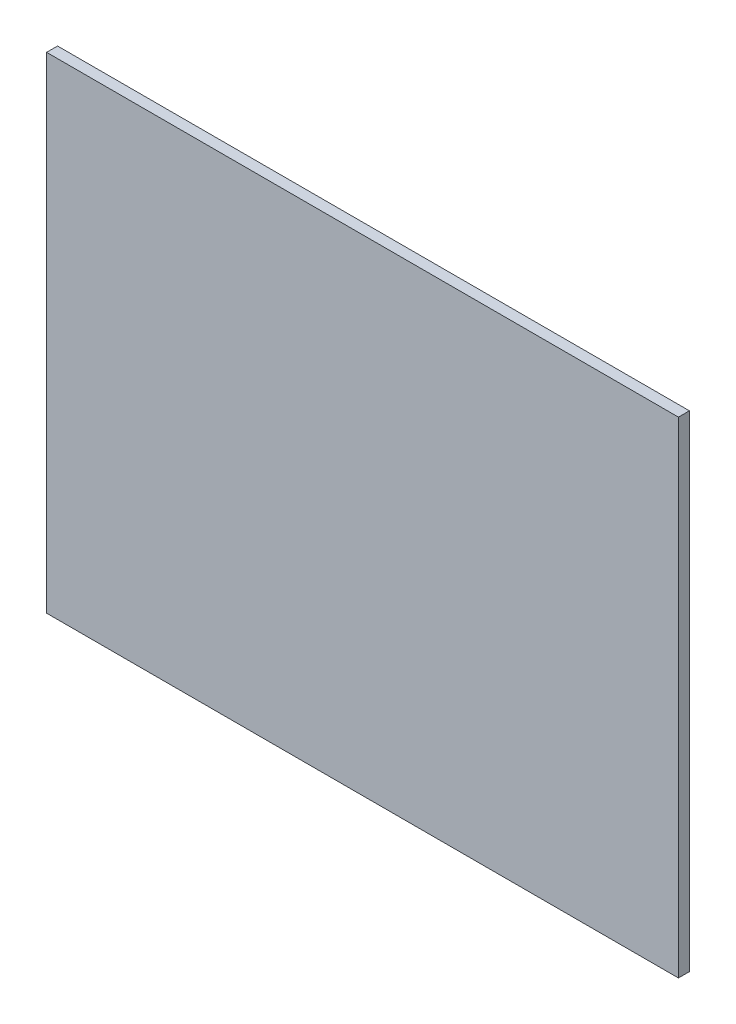
from build123d import *

# Parameters (mm, degrees)
ESQUISSE1_W        = 173
ESQUISSE1_H        = 133
BOSS_EXTRU_1_DEPTH = 3


with BuildPart() as part:
    # Esquisse1 → Boss.-Extru.1 (new body)
    with BuildSketch(Plane.XY):
        with Locations((48.424323811, -37.469926441)):
            Rectangle(ESQUISSE1_W, ESQUISSE1_H)
    extrude(amount=BOSS_EXTRU_1_DEPTH)


solid = part.part
